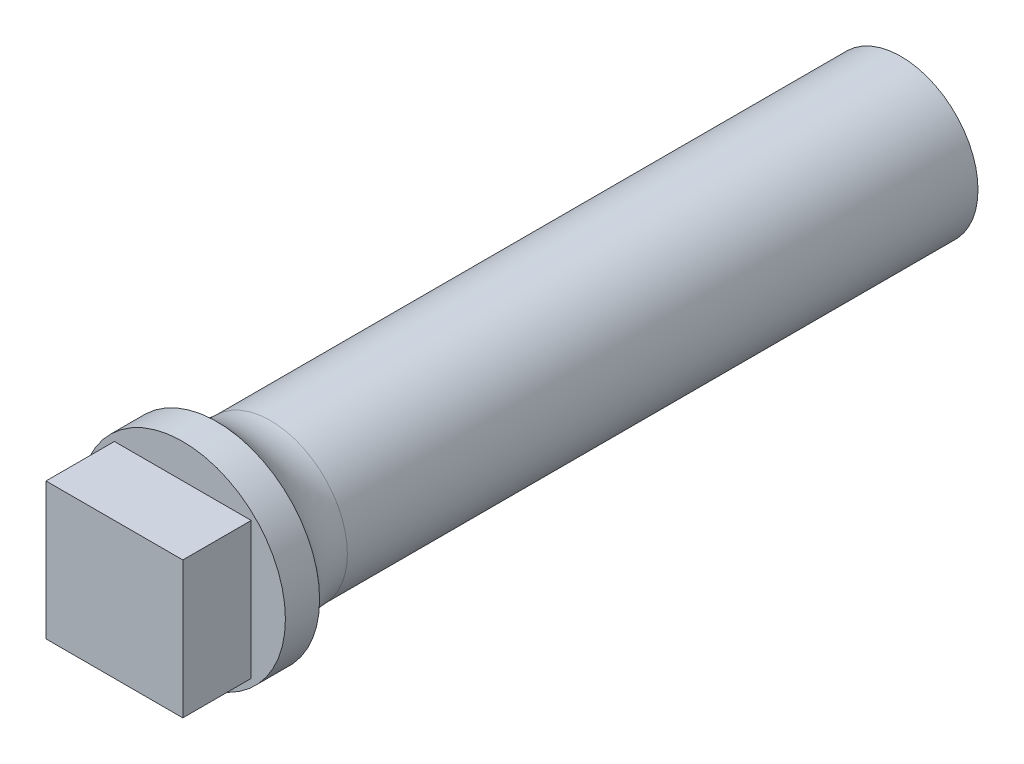
from build123d import *

# Parameters (mm, degrees)
SKETCH_1_R          = 2.25
EXTRUDE_2_DEPTH     = 20
SKETCH_7_W          = 2.4
SKETCH_7_H          = 2.4
CUT_EXTRUDE_3_DEPTH = 2.5
SKETCH_9_R          = 3
EXTRUDE_4_DEPTH     = 1
SKETCH_10_W         = 4
SKETCH_10_H         = 4
EXTRUDE_5_DEPTH     = 2
FILLET_1_R          = 2


with BuildPart() as part:
    # 草图1 → 凸台-拉伸2 (new body)
    with BuildSketch(Plane.XY):
        Circle(SKETCH_1_R)
    extrude(amount=EXTRUDE_2_DEPTH)

    # 草图7 → 切除-拉伸3 (cut)
    with BuildSketch(Plane.XY):
        Rectangle(SKETCH_7_W, SKETCH_7_H)
    extrude(amount=CUT_EXTRUDE_3_DEPTH, mode=Mode.SUBTRACT)

    # 草图9 → 凸台-拉伸4 (add)
    with BuildSketch(Plane.XY.offset(20)):
        Circle(SKETCH_9_R)
    extrude(amount=EXTRUDE_4_DEPTH)

    # 草图10 → 凸台-拉伸5 (add)
    with BuildSketch(Plane.XY.offset(21)):
        Rectangle(SKETCH_10_W, SKETCH_10_H)
    extrude(amount=EXTRUDE_5_DEPTH)

    # 圆角1
    # the kernel refuses this fillet: 2 mm, written as the material it adds along each edge
    with BuildSketch(Plane(origin=(0, 0, 20), x_dir=(1, 0, 0), z_dir=(0, -1, 0))) as fillet_1_piece_1:
        with BuildLine():
            CenterArc((4.25, -1.5612495), FILLET_1_R, 128.682187453, 51.317812547)
            Line((2.25, -1.5612495), (2.21, -1.5612495))
            Line((2.21, -1.5612495), (2.21, 0))
            Line((2.21, 0), (2.25, 0.04))
            ThreePointArc((2.25, 0.04), (2.625, 0.04), (2.975, 0.03122499))
            Line((2.975, 0.03122499), (3, 0))
        make_face()
    revolve(axis=Axis((0, 0, 20), (0, 0, 1)))


solid = part.part
